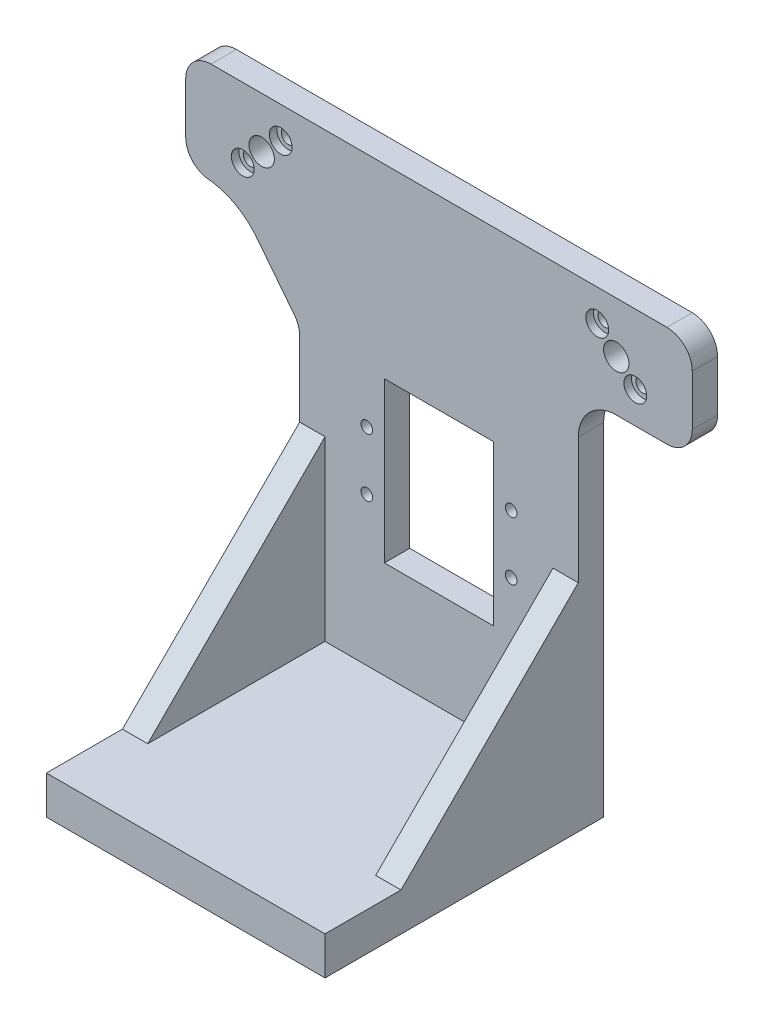
from build123d import *

# Parameters (mm, degrees)
SKIZZE1_R                       = 2.3
SKIZZE1_R_2                     = 5
SKIZZE1_R_3                     = 2.75
SKIZZE1_W                       = 43.1
SKIZZE1_H                       = 63
AUFSATZ_LINEAR_AUSTRAGEN1_DEPTH = 10
AUFSATZ_LINEAR_AUSTRAGEN3_DEPTH = 10
SKIZZE4_W                       = 110
SKIZZE4_H                       = 15.089693508
AUFSATZ_LINEAR_AUSTRAGEN4_DEPTH = 100
VERRUNDUNG5_R                   = 10
SKIZZE11_R                      = 4.5
SCHNITT_LINEAR_AUSTRAGEN1_DEPTH = 3
SCHNITT_LINEAR_AUSTRAGEN2_DEPTH = 3
AUFSATZ_LINEAR_AUSTRAGEN7_DEPTH = 10
AUFSATZ_LINEAR_AUSTRAGEN8_DEPTH = 10


with BuildPart() as part:
    # Skizze1 → Aufsatz-Linear austragen1 (new body)
    with BuildSketch(Plane.XY):
        with BuildLine():
            Line((90, 107.054645521), (-90, 107.054645521))
            ThreePointArc((-90, 107.054645521), (-97.071067812, 104.125713333), (-100, 97.054645521))
            Line((-100, 97.054645521), (-100, 77.054645521))
            ThreePointArc((-100, 77.054645521), (-97.071067812, 69.983577709), (-90, 67.054645521))
            Line((-90, 67.054645521), (-70, 67.054645521))
            ThreePointArc((-70, 67.054645521), (-59.393398282, 62.661247239), (-55, 52.054645521))
            Line((-55, 52.054645521), (-55, -82.945354479))
            Line((-55, -82.945354479), (55, -82.945354479))
            Line((55, -82.945354479), (55, 52.054645521))
            ThreePointArc((55, 52.054645521), (59.393398282, 62.661247239), (70, 67.054645521))
            Line((70, 67.054645521), (90, 67.054645521))
            ThreePointArc((90, 67.054645521), (97.071067812, 69.983577709), (100, 77.054645521))
            Line((100, 77.054645521), (100, 97.054645521))
            ThreePointArc((100, 97.054645521), (97.071067812, 104.125713333), (90, 107.054645521))
        make_face()
        with Locations((-28.5, 13.704645521)):
            Circle(SKIZZE1_R, mode=Mode.SUBTRACT)
        with Locations((-28.5, -9.295354479)):
            Circle(SKIZZE1_R, mode=Mode.SUBTRACT)
        with Locations(Location((28.5, -9.295354479, 0), (0, 0, 180))):
            Circle(SKIZZE1_R, mode=Mode.SUBTRACT)
        with Locations(Location((28.5, 13.704645521, 0), (0, 0, 180))):
            Circle(SKIZZE1_R, mode=Mode.SUBTRACT)
        with Locations((-70, 87.054645521)):
            Circle(SKIZZE1_R_2, mode=Mode.SUBTRACT)
        with Locations((-62.5, 94.554645521)):
            Circle(SKIZZE1_R_3, mode=Mode.SUBTRACT)
        with Locations((-77.5, 79.554645521)):
            Circle(SKIZZE1_R_3, mode=Mode.SUBTRACT)
        with Locations(Location((77.5, 79.554645521, 0), (0, 0, 180))):
            Circle(SKIZZE1_R_3, mode=Mode.SUBTRACT)
        with Locations(Location((62.5, 94.554645521, 0), (0, 0, 180))):
            Circle(SKIZZE1_R_3, mode=Mode.SUBTRACT)
        with Locations(Location((70, 87.054645521, 0), (0, 0, 180))):
            Circle(SKIZZE1_R_2, mode=Mode.SUBTRACT)
        with Locations((0, 2.204645521)):
            Rectangle(SKIZZE1_W, SKIZZE1_H, mode=Mode.SUBTRACT)
    extrude(amount=AUFSATZ_LINEAR_AUSTRAGEN1_DEPTH)

    # Skizze3 → Aufsatz-Linear austragen3 (add)
    with BuildSketch(Plane.XY.offset(10)):
        with BuildLine():
            Line((-72.845922337, 57.814606503), (-56.774282723, 37.352261221))
            add(Edge.make_bspline(
                [(-55, 18.961003518), (-46.636539725, 27.963101216), (-56.774282723, 37.352261221)],
                knots=[0, 0, 0, 1, 1, 1], degree=2))
            Line((-55, 18.961003518), (-43.333440031, 21.200490786))
            Line((-43.333440031, 21.200490786), (-45.498025685, 67.054645521))
            Line((-45.498025685, 67.054645521), (-90, 67.054645521))
            add(Edge.make_bspline(
                [(-90, 67.054645521), (-79.938268155, 65.656359823), (-72.845922337, 57.814606503)],
                knots=[0, 0, 0, 1, 1, 1], degree=2))
        make_face()
    extrude(amount=-AUFSATZ_LINEAR_AUSTRAGEN3_DEPTH)

    # Skizze4 → Aufsatz-Linear austragen4 (add)
    with BuildSketch(Plane.XY.offset(10)):
        with Locations((0, -75.400507725)):
            Rectangle(SKIZZE4_W, SKIZZE4_H)
    extrude(amount=AUFSATZ_LINEAR_AUSTRAGEN4_DEPTH)

    # Verrundung5
    # the kernel refuses this fillet: 10 mm, written as the material it adds along each edge
    with BuildSketch(Plane(origin=(-55, 35.554962551, 0), x_dir=(-0.702535464065595, 0.7116487347913572, 0), z_dir=(0, 0, 1))) as verrundung5_piece_1:
        with BuildLine():
            CenterArc((4.257528526, 9.848869082), VERRUNDUNG5_R, 225.36921974, 34.65693161)
            Line((-2.767826115, 2.732381734), (-2.908333207, 2.590051987))
            Line((-2.908333207, 2.590051987), (-0.140507093, -0.142329747))
            Line((-0.140507093, -0.142329747), (-0.009856246, -0.199756988))
            ThreePointArc((-0.009856246, -0.199756988), (1.263031351, -0.229630028), (2.490902127, -0.196977382))
            Line((2.490902127, -0.196977382), (2.52554186, 0))
        make_face()
    extrude(amount=10)

    # Skizze11 → Schnitt-Linear austragen1 (cut)
    with BuildSketch(Plane.XY.offset(10)):
        with Locations((62.5, 94.554645521)):
            Circle(SKIZZE11_R)
        with Locations((77.5, 79.554645521)):
            Circle(SKIZZE11_R)
        with Locations((-62.5, 94.554645521)):
            Circle(SKIZZE11_R)
        with Locations((-77.5, 79.554645521)):
            Circle(SKIZZE11_R)
    extrude(amount=-SCHNITT_LINEAR_AUSTRAGEN1_DEPTH, mode=Mode.SUBTRACT)

    # Skizze12 → Schnitt-Linear austragen2 (cut)
    with BuildSketch(Plane(origin=(0, 0, 0), x_dir=(-1, 0, 0), z_dir=(0, 0, -1))):
        Polygon((28.5, 17.747145521), (24.825, 15.787145521), (24.825, 11.622145521), (28.5, 9.662145521), (32.175, 11.622145521), (32.175, 15.787145521), align=None)
        Polygon((28.5, -5.252854479), (24.825, -7.212854479), (24.825, -11.377854479), (28.5, -13.337854479), (32.175, -11.377854479), (32.175, -7.212854479), align=None)
        Polygon((-28.5, -5.252854479), (-32.175, -7.212854479), (-32.175, -11.377854479), (-28.5, -13.337854479), (-24.825, -11.377854479), (-24.825, -7.212854479), align=None)
        Polygon((-28.5, 17.747145521), (-32.175, 15.787145521), (-32.175, 11.622145521), (-28.5, 9.662145521), (-24.825, 11.622145521), (-24.825, 15.787145521), align=None)
    extrude(amount=-SCHNITT_LINEAR_AUSTRAGEN2_DEPTH, mode=Mode.SUBTRACT)

    # Skizze15 → Aufsatz-Linear austragen7 (add)
    with BuildSketch(Plane.ZY.offset(55)):
        Polygon((10, 2.144339029), (80, -67.855660971), (10, -67.855660971), align=None)
    extrude(amount=-AUFSATZ_LINEAR_AUSTRAGEN7_DEPTH)

    # Skizze16 → Aufsatz-Linear austragen8 (add)
    with BuildSketch(Plane(origin=(55, 0, 0), x_dir=(0, 0, -1), z_dir=(1, 0, 0))):
        Polygon((-10, 2.204645521), (-80, -67.855660971), (-10, -67.855660971), align=None)
    extrude(amount=-AUFSATZ_LINEAR_AUSTRAGEN8_DEPTH)


solid = part.part
